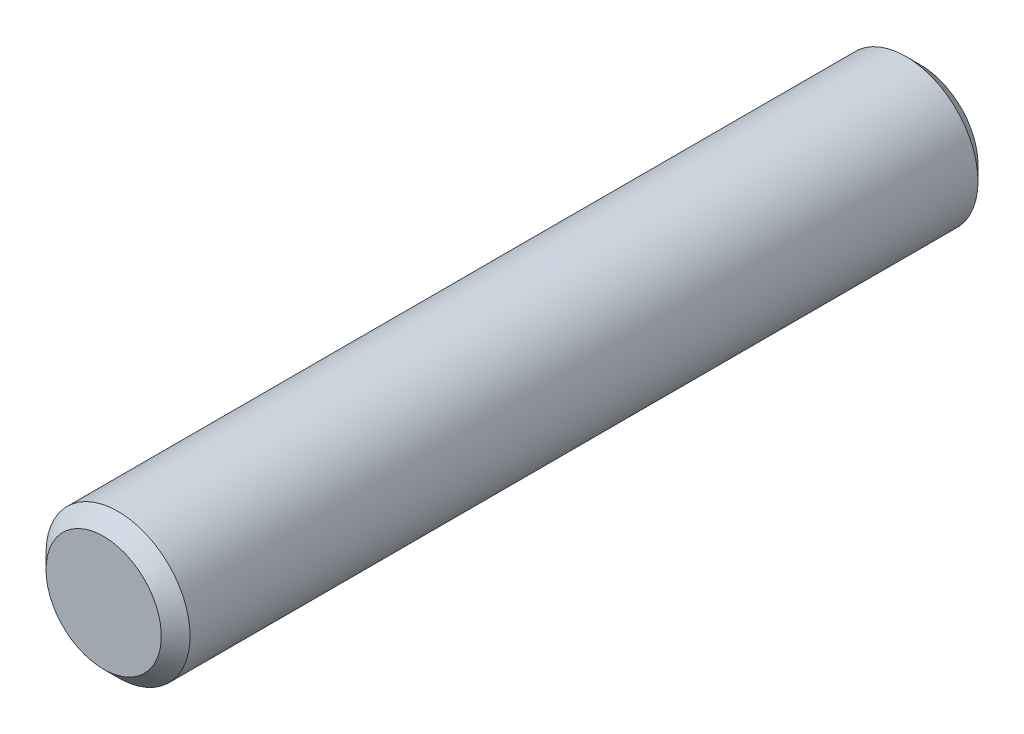
from build123d import *

# Parameters (mm, degrees)
SKETCH3_R           = 7.9375
BOSS_EXTRUDE1_DEPTH = 45
CHAMFER1_SIZE       = 1.5875


with BuildPart() as part:
    # Sketch3 → Boss-Extrude1 (new, symmetric)
    with BuildSketch(Plane.XY):
        Circle(SKETCH3_R)
    extrude(amount=BOSS_EXTRUDE1_DEPTH, both=True)

    # Chamfer1
    chamfer1_edges = [part.edges().sort_by_distance(p)[0] for p in [
        (-7.9375, 0, -45),
        (-7.9375, 0, 45),
    ]]
    chamfer(chamfer1_edges, length=CHAMFER1_SIZE)


solid = part.part
